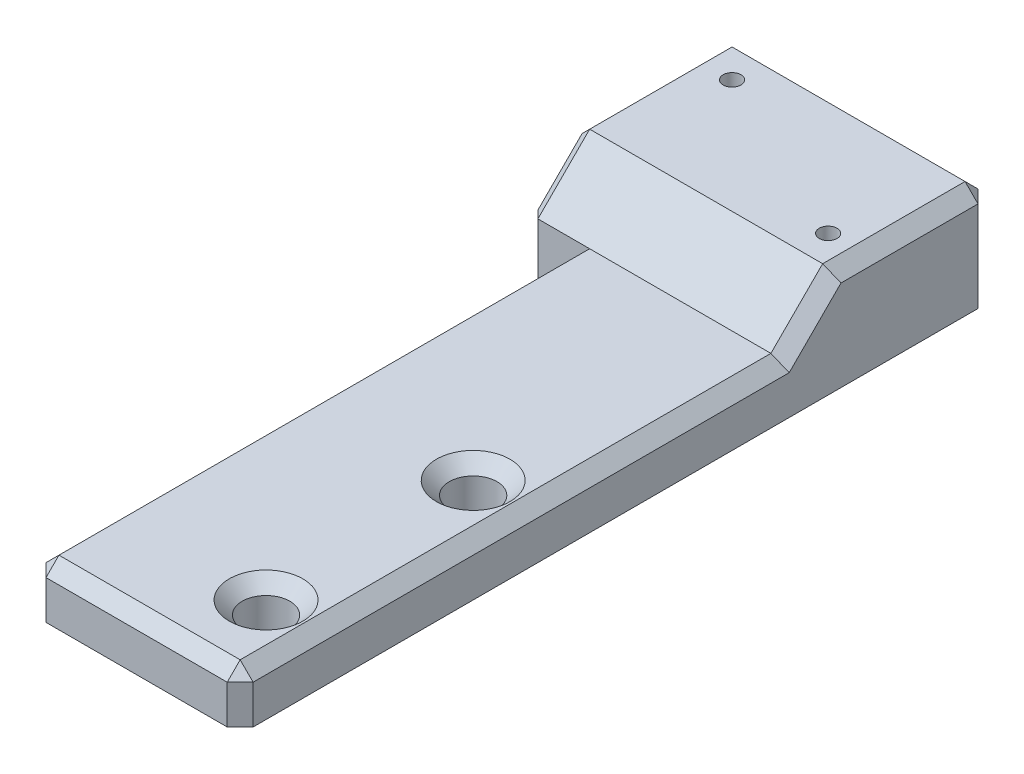
from build123d import *

# Parameters (mm, degrees)
SKETCH1_W           = 31.75
SKETCH1_H           = 92.075
SKETCH1_R           = 2.921
BOSS_EXTRUDE1_DEPTH = 12.7
SKETCH2_W           = 66.675
SKETCH2_H           = 6.35
CUT_EXTRUDE1_DEPTH  = 99.219947694
SKETCH3_R           = 1.0922
SKETCH3_W           = 6.35
SKETCH3_H           = 66.675
CUT_EXTRUDE2_DEPTH  = 99.219947694
CHAMFER1_SIZE       = 6.35
CHAMFER2_SIZE       = 1.5875


with BuildPart() as part:
    # Sketch1 → Boss-Extrude1 (new body)
    with BuildSketch(Plane(origin=(0, 0, 0), x_dir=(1, 0, 0), z_dir=(0, 1, 0))):
        with Locations((15.875, 46.0375)):
            Rectangle(SKETCH1_W, SKETCH1_H)
        with Locations((25.4, 9.525)):
            Circle(SKETCH1_R, mode=Mode.SUBTRACT)
        with Locations((25.4, 34.925)):
            Circle(SKETCH1_R, mode=Mode.SUBTRACT)
    extrude(amount=BOSS_EXTRUDE1_DEPTH)

    # Sketch2 → Cut-Extrude1 (cut, through all)
    with BuildSketch(Plane(origin=(31.75, 0, 0), x_dir=(0, 0, -1), z_dir=(1, 0, 0))):
        with Locations((33.3375, 9.525)):
            Rectangle(SKETCH2_W, SKETCH2_H)
    extrude(amount=-CUT_EXTRUDE1_DEPTH, mode=Mode.SUBTRACT)

    # Sketch3 → Cut-Extrude2 (cut, through all)
    with BuildSketch(Plane.XZ):
        with Locations((27.2796, -76.581)):
            Circle(SKETCH3_R)
        with Locations((5.08, -86.995)):
            Circle(SKETCH3_R)
        with Locations((3.175, -33.3375)):
            Rectangle(SKETCH3_W, SKETCH3_H)
    extrude(amount=-CUT_EXTRUDE2_DEPTH, mode=Mode.SUBTRACT)

    # Chamfer1
    chamfer1_edges = [part.edges().sort_by_distance(p)[0] for p in [
        (15.875, 12.7, -66.675),
    ]]
    chamfer(chamfer1_edges, length=CHAMFER1_SIZE)

    # Chamfer2
    chamfer2_edges = [part.edges().sort_by_distance(p)[0] for p in [
        (22.479, 6.35, -9.525),
        (22.479, 6.35, -34.925),
        (31.75, 6.35, -92.075),
        (31.75, 3.175, 0),
        (6.35, 3.175, 0),
        (6.35, 6.35, -33.3375),
        (19.05, 6.35, 0),
        (31.75, 6.35, -33.3375),
        (31.75, 9.525, -69.85),
        (31.75, 12.7, -82.55),
        (0, 6.35, -92.075),
        (15.875, 12.7, -92.075),
        (0, 12.7, -82.55),
        (0, 9.525, -69.85),
        (0, 3.175, -66.675),
    ]]
    chamfer(chamfer2_edges, length=CHAMFER2_SIZE)


solid = part.part
